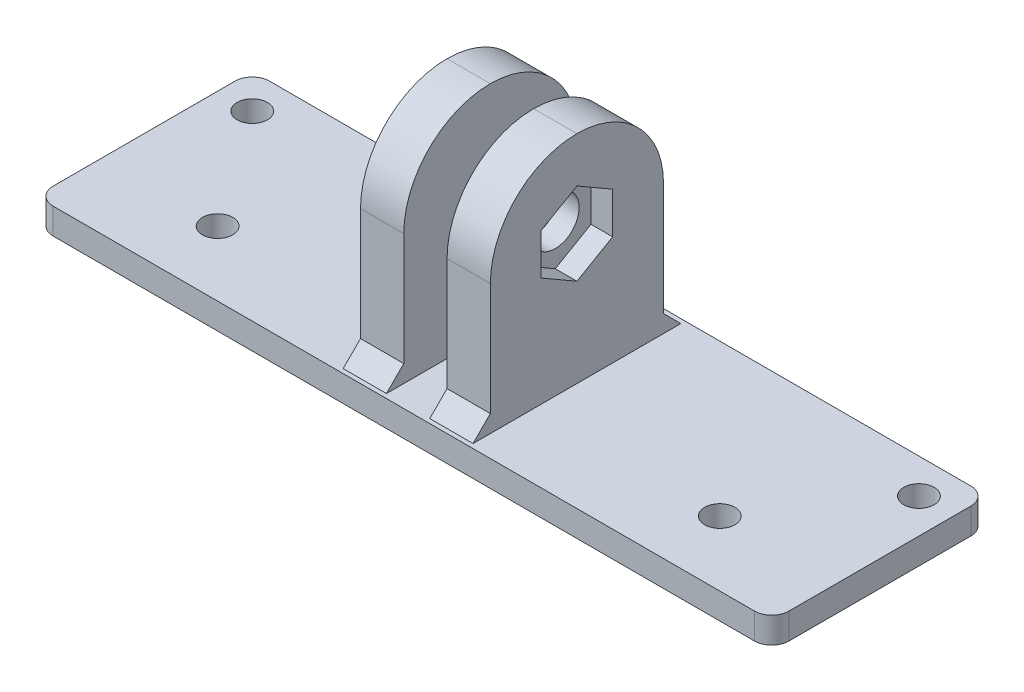
from build123d import *

# Parameters (mm, degrees)
SKETCH1_W               = 85
SKETCH1_H               = 25
BOSS_EXTRUDE1_DEPTH     = 3
SKETCH3_R               = 1.75
CUT_EXTRUDE2_DEPTH      = 45.401576549
FILLET2_R               = 2
SKETCH4_W               = 5
SKETCH4_H               = 20
BOSS_EXTRUDE2_DEPTH     = 25
FILLET3_R               = 10
CUT_EXTRUDE3_DEPTH      = 59.653644388
CUT_EXTRUDE3_DEPTH_BACK = 59.653644388
SKETCH5_R               = 2.75
CUT_EXTRUDE4_DEPTH      = 2.5
CHAMFER1_SIZE           = 2


with BuildPart() as part:
    # Sketch1 → Boss-Extrude1 (new body)
    with BuildSketch(Plane(origin=(0, 0, 0), x_dir=(1, 0, 0), z_dir=(0, 1, 0))):
        Rectangle(SKETCH1_W, SKETCH1_H)
    extrude(amount=BOSS_EXTRUDE1_DEPTH)

    # Sketch3 → Cut-Extrude2 (cut, through all)
    with BuildSketch(Plane(origin=(0, 3, 0), x_dir=(1, 0, 0), z_dir=(0, 1, 0))):
        with Locations(Location((-38.5, 8.5, 0), (0, 0, 270))):
            Circle(SKETCH3_R)
        with Locations(Location((38.5, 8.5, 0), (0, 0, 90))):
            Circle(SKETCH3_R)
        with Locations(Location((-29, -5, 0), (0, 0, 270))):
            Circle(SKETCH3_R)
        with Locations(Location((29, -5, 0), (0, 0, 90))):
            Circle(SKETCH3_R)
    extrude(amount=-CUT_EXTRUDE2_DEPTH, mode=Mode.SUBTRACT)

    # Fillet2
    fillet2_edges = [part.edges().sort_by_distance(p)[0] for p in [
        (-42.5, 1.5, -12.5),
        (42.5, 1.5, -12.5),
        (42.5, 1.5, 12.5),
        (-42.5, 1.5, 12.5),
    ]]
    fillet(fillet2_edges, radius=FILLET2_R)

    # Sketch4 → Boss-Extrude2 (add)
    with BuildSketch(Plane(origin=(0, 3, 0), x_dir=(1, 0, 0), z_dir=(0, 1, 0))):
        with Locations((-5, 0)):
            Rectangle(SKETCH4_W, SKETCH4_H)
        with Locations((5, 0)):
            Rectangle(SKETCH4_W, SKETCH4_H)
    extrude(amount=BOSS_EXTRUDE2_DEPTH)

    # Fillet3
    fillet3_edges = [part.edges().sort_by_distance(p)[0] for p in [
        (5, 28, 10),
        (5, 28, -10),
        (-5, 28, -10),
        (-5, 28, 10),
    ]]
    fillet(fillet3_edges, radius=FILLET3_R - 0.0001)  # a hair under: the kernel refuses the full size

    # Sketch5 → Cut-Extrude3 (cut, two sides: drawn at the far end of the back side and taken through both)
    with BuildSketch(Plane.ZY.offset(7.5).offset(-CUT_EXTRUDE3_DEPTH_BACK)):
        with Locations((0, 18)):
            Circle(SKETCH5_R)
    extrude(amount=CUT_EXTRUDE3_DEPTH + CUT_EXTRUDE3_DEPTH_BACK, mode=Mode.SUBTRACT)

    # Sketch6 → Cut-Extrude4 (cut)
    with BuildSketch(Plane(origin=(7.5, 0, 0), x_dir=(0, 0, -1), z_dir=(1, 0, 0))):
        Polygon((0, 13.236860279), (4.125, 15.61843014), (4.125, 20.38156986), (0, 22.763139721), (-4.125, 20.38156986), (-4.125, 15.61843014), align=None)
    extrude(amount=-CUT_EXTRUDE4_DEPTH, mode=Mode.SUBTRACT)

    # Chamfer1
    chamfer1_edges = [part.edges().sort_by_distance(p)[0] for p in [
        (-5, 3, -10),
        (-5, 3, 10),
        (5, 3, -10),
        (5, 3, 10),
    ]]
    chamfer(chamfer1_edges, length=CHAMFER1_SIZE)


solid = part.part
